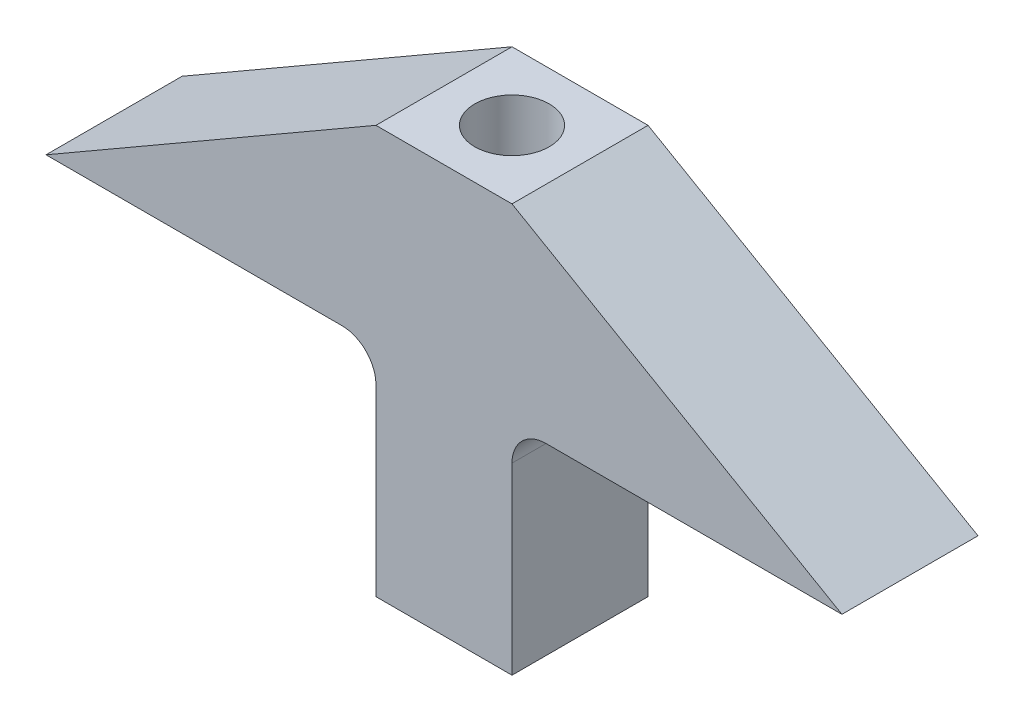
from build123d import *

# Parameters (mm, degrees)
BOSS_EXTRUDE1_DEPTH                  = 25.4
F_35_64_0_54688_DIAMETER_HOLE1_D     = 13.890752
F_35_64_0_54688_DIAMETER_HOLE1_DEPTH = 35.052
F_35_64_0_54688_DIAMETER_HOLE1_TIP   = 4.173202923
F_10_32_TAPPED_HOLE1_D               = 4.0386
F_10_32_TAPPED_HOLE1_DEPTH           = 8.636
F_10_32_TAPPED_HOLE1_TIP             = 1.213317848
FILLET1_R                            = 6.35


with BuildPart() as part:
    # Sketch1 → Boss-Extrude1 (new body)
    with BuildSketch(Plane.XY):
        Polygon((0, 0), (61.591726717, 0), (61.591726717, -40.64), (86.991726717, -40.64), (86.991726717, 0), (148.583453434, 0), (86.991726717, 35.56), (61.591726717, 35.56), align=None)
    extrude(amount=BOSS_EXTRUDE1_DEPTH)

    # 35/64 (0.54688) Diameter Hole1
    with Locations(Plane(origin=(0, 35.56, 0), x_dir=(1, 0, 0), z_dir=(0, 1, 0))):
        with Locations((74.291726717, -12.7)):
            Hole(F_35_64_0_54688_DIAMETER_HOLE1_D / 2, depth=F_35_64_0_54688_DIAMETER_HOLE1_DEPTH)
            with Locations((0, 0, -(F_35_64_0_54688_DIAMETER_HOLE1_DEPTH + F_35_64_0_54688_DIAMETER_HOLE1_TIP / 2))):  # 118° drill point
                Cone(0, F_35_64_0_54688_DIAMETER_HOLE1_D / 2, F_35_64_0_54688_DIAMETER_HOLE1_TIP, mode=Mode.SUBTRACT)

    # #10-32 Tapped Hole1
    with Locations(Plane(origin=(0, -40.64, 0), x_dir=(-1, 0, 0), z_dir=(0, -1, 0))):
        with Locations((-77.466726717, -15.875), (-71.116726717, -9.525)):
            Hole(F_10_32_TAPPED_HOLE1_D / 2, depth=F_10_32_TAPPED_HOLE1_DEPTH)
            with Locations((0, 0, -(F_10_32_TAPPED_HOLE1_DEPTH + F_10_32_TAPPED_HOLE1_TIP / 2))):  # 118° drill point
                Cone(0, F_10_32_TAPPED_HOLE1_D / 2, F_10_32_TAPPED_HOLE1_TIP, mode=Mode.SUBTRACT)

    # Fillet1
    fillet1_edges = [part.edges().sort_by_distance(p)[0] for p in [
        (86.991726717, 0, 12.7),
        (61.591726717, 0, 12.7),
    ]]
    fillet(fillet1_edges, radius=FILLET1_R)


solid = part.part
